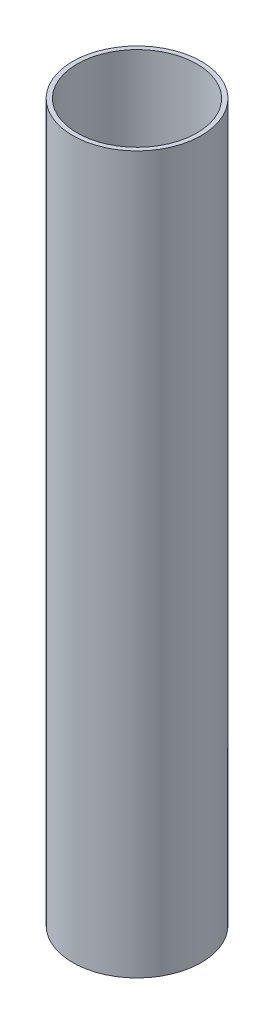
from build123d import *

# Parameters (mm, degrees)
SKETCH1_W = 1.4224
SKETCH1_H = 228.6


with BuildPart() as part:
    # Sketch1 → Revolve2 (revolve)
    with BuildSketch(Plane.XY):
        with Locations((-19.812, 114.3)):
            Rectangle(SKETCH1_W, SKETCH1_H)
    revolve(axis=Axis((0, 0, 0), (0, 1, 0)))


solid = part.part
